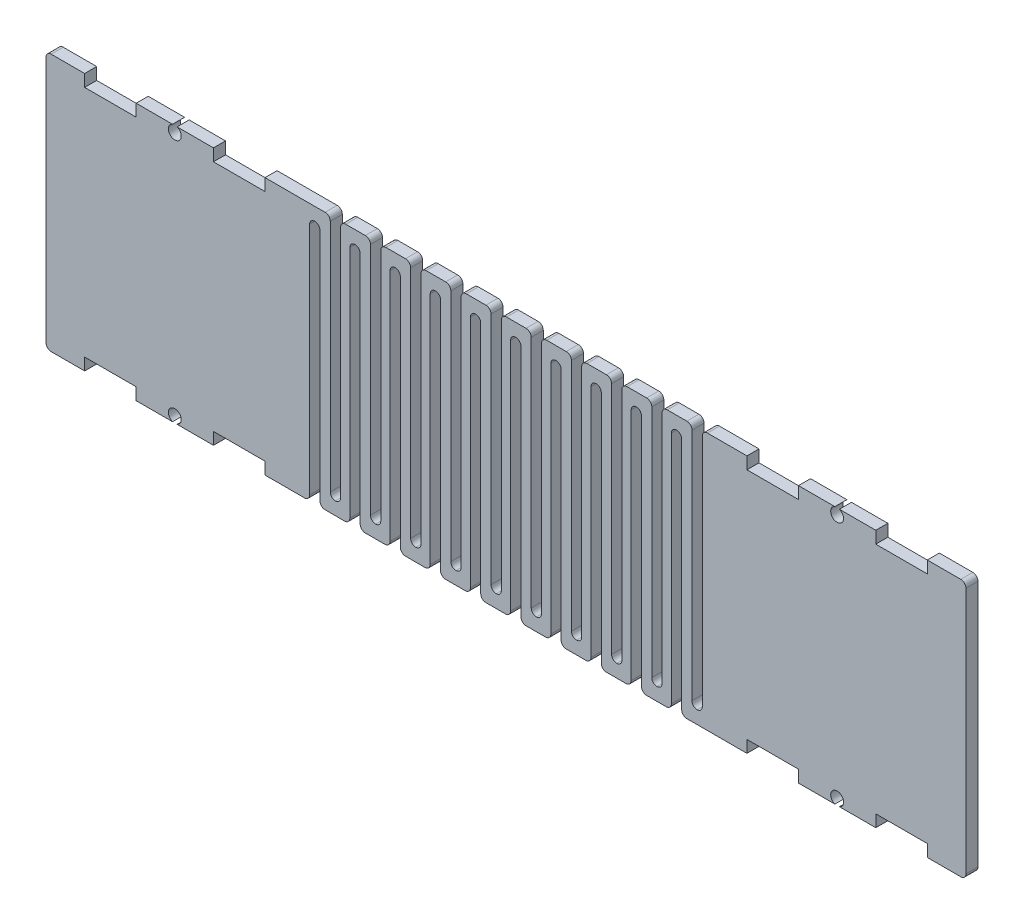
from build123d import *

# Parameters (mm, degrees)
SKETCH1_W               = 226.745566752
SKETCH1_H               = 63.5
BOSS_EXTRUDE1_DEPTH     = 1.4859
CUT_EXTRUDE2_DEPTH      = 118.74403768
CUT_EXTRUDE2_DEPTH_BACK = 118.74403768
SKETCH3_W               = 2.54
SKETCH3_H               = 60.325
FILLET1_R               = 1.27
SKETCH2_R               = 1.5875
SKETCH2_W               = 12.7
SKETCH2_H               = 2.9718
CUT_EXTRUDE1_DEPTH      = 118.772161845


with BuildPart() as part:
    # Sketch1 → Boss-Extrude1 (new, symmetric)
    with BuildSketch(Plane.XY):
        Rectangle(SKETCH1_W, SKETCH1_H)
    extrude(amount=BOSS_EXTRUDE1_DEPTH, both=True)

    # Sketch3 → Cut-Extrude2 (cut, two sides: drawn at the far end of the back side and taken through both)
    with BuildSketch(Plane.XY.offset(-CUT_EXTRUDE2_DEPTH_BACK)):
        with Locations((-37.210909292, -1.5875)):
            Rectangle(SKETCH3_W, SKETCH3_H)
        with Locations((-47.116883376, -1.5875)):
            Rectangle(SKETCH3_W, SKETCH3_H)
        with Locations((-42.036883376, 1.5875)):
            Rectangle(SKETCH3_W, SKETCH3_H)
        with Locations((-32.130909292, 1.5875)):
            Rectangle(SKETCH3_W, SKETCH3_H)
        with Locations((-27.304935209, -1.5875)):
            Rectangle(SKETCH3_W, SKETCH3_H)
        with Locations((-22.224935209, 1.5875)):
            Rectangle(SKETCH3_W, SKETCH3_H)
        with Locations((-17.398961125, -1.5875)):
            Rectangle(SKETCH3_W, SKETCH3_H)
        with Locations((-12.318961125, 1.5875)):
            Rectangle(SKETCH3_W, SKETCH3_H)
        with Locations((-7.492987042, -1.5875)):
            Rectangle(SKETCH3_W, SKETCH3_H)
        with Locations((-2.412987042, 1.5875)):
            Rectangle(SKETCH3_W, SKETCH3_H)
        with Locations((2.412987042, -1.5875)):
            Rectangle(SKETCH3_W, SKETCH3_H)
        with Locations((7.492987042, 1.5875)):
            Rectangle(SKETCH3_W, SKETCH3_H)
        with Locations((12.318961125, -1.5875)):
            Rectangle(SKETCH3_W, SKETCH3_H)
        with Locations((17.398961125, 1.5875)):
            Rectangle(SKETCH3_W, SKETCH3_H)
        with Locations((22.224935209, -1.5875)):
            Rectangle(SKETCH3_W, SKETCH3_H)
        with Locations((27.304935209, 1.5875)):
            Rectangle(SKETCH3_W, SKETCH3_H)
        with Locations((32.130909292, -1.5875)):
            Rectangle(SKETCH3_W, SKETCH3_H)
        with Locations((37.210909292, 1.5875)):
            Rectangle(SKETCH3_W, SKETCH3_H)
        with Locations((42.036883376, -1.5875)):
            Rectangle(SKETCH3_W, SKETCH3_H)
        with Locations((47.116883376, 1.5875)):
            Rectangle(SKETCH3_W, SKETCH3_H)
    extrude(amount=CUT_EXTRUDE2_DEPTH + CUT_EXTRUDE2_DEPTH_BACK, mode=Mode.SUBTRACT)

    # Fillet1
    fillet1_edges = [part.edges().sort_by_distance(p)[0] for p in [
        (-45.846883376, 28.575, 0),
        (-38.480909292, -31.75, 0),
        (-38.480909292, 28.575, 0),
        (-35.940909292, 28.575, 0),
        (-35.940909292, -31.75, 0),
        (-28.574935209, -31.75, 0),
        (-28.574935209, 28.575, 0),
        (-26.034935209, 28.575, 0),
        (-26.034935209, -31.75, 0),
        (-18.668961125, -31.75, 0),
        (-18.668961125, 28.575, 0),
        (-16.128961125, 28.575, 0),
        (-16.128961125, -31.75, 0),
        (-8.762987042, -31.75, 0),
        (-8.762987042, 28.575, 0),
        (-6.222987042, 28.575, 0),
        (-6.222987042, -31.75, 0),
        (1.142987042, -31.75, 0),
        (1.142987042, 28.575, 0),
        (3.682987042, 28.575, 0),
        (3.682987042, -31.75, 0),
        (11.048961125, -31.75, 0),
        (11.048961125, 28.575, 0),
        (13.588961125, 28.575, 0),
        (13.588961125, -31.75, 0),
        (20.954935209, -31.75, 0),
        (20.954935209, 28.575, 0),
        (23.494935209, 28.575, 0),
        (23.494935209, -31.75, 0),
        (28.574935209, 31.75, 0),
        (28.574935209, -28.575, 0),
        (26.034935209, -28.575, 0),
        (26.034935209, 31.75, 0),
        (18.668961125, 31.75, 0),
        (18.668961125, -28.575, 0),
        (16.128961125, -28.575, 0),
        (16.128961125, 31.75, 0),
        (8.762987042, 31.75, 0),
        (8.762987042, -28.575, 0),
        (6.222987042, -28.575, 0),
        (6.222987042, 31.75, 0),
        (-1.142987042, 31.75, 0),
        (-1.142987042, -28.575, 0),
        (-3.682987042, -28.575, 0),
        (-3.682987042, 31.75, 0),
        (-11.048961125, 31.75, 0),
        (-11.048961125, -28.575, 0),
        (-13.588961125, -28.575, 0),
        (-13.588961125, 31.75, 0),
        (-20.954935209, 31.75, 0),
        (-20.954935209, -28.575, 0),
        (-23.494935209, -28.575, 0),
        (-23.494935209, 31.75, 0),
        (-30.860909292, 31.75, 0),
        (-30.860909292, -28.575, 0),
        (-33.400909292, -28.575, 0),
        (-33.400909292, 31.75, 0),
        (-40.766883376, 31.75, 0),
        (-40.766883376, -28.575, 0),
        (-43.306883376, -28.575, 0),
        (-43.306883376, 31.75, 0),
        (-48.386883376, -31.75, 0),
        (-48.386883376, 28.575, 0),
        (-45.846883376, -31.75, 0),
        (30.860909292, 28.575, 0),
        (33.400909292, 28.575, 0),
        (33.400909292, -31.75, 0),
        (40.766883376, -31.75, 0),
        (40.766883376, 28.575, 0),
        (43.306883376, 28.575, 0),
        (43.306883376, -31.75, 0),
        (113.372783376, -31.75, 0),
        (113.372783376, 31.75, 0),
        (48.386883376, 31.75, 0),
        (48.386883376, -28.575, 0),
        (45.846883376, -28.575, 0),
        (45.846883376, 31.75, 0),
        (38.480909292, 31.75, 0),
        (38.480909292, -28.575, 0),
        (35.940909292, -28.575, 0),
        (35.940909292, 31.75, 0),
        (-113.372783376, 31.75, 0),
        (-113.372783376, -31.75, 0),
        (30.860909292, -31.75, 0),
    ]]
    fillet(fillet1_edges, radius=FILLET1_R - 0.0001)  # a hair under: the kernel refuses the full size

    # Sketch2 → Cut-Extrude1 (cut, through all)
    with BuildSketch(Plane.XY.offset(1.4859)):
        with Locations((-81.622783376, -30.2641)):
            Circle(SKETCH2_R)
        with Locations((-81.622783376, 30.2641)):
            Circle(SKETCH2_R)
        with Locations((81.622783376, 30.2641)):
            Circle(SKETCH2_R)
        with Locations((81.622783376, -30.2641)):
            Circle(SKETCH2_R)
        with Locations((-97.497783376, -30.2641)):
            Rectangle(SKETCH2_W, SKETCH2_H)
        with Locations((-65.747783376, -30.2641)):
            Rectangle(SKETCH2_W, SKETCH2_H)
        with Locations((-65.747783376, 30.2641)):
            Rectangle(SKETCH2_W, SKETCH2_H)
        with Locations((-97.497783376, 30.2641)):
            Rectangle(SKETCH2_W, SKETCH2_H)
        with Locations((97.497783376, 30.2641)):
            Rectangle(SKETCH2_W, SKETCH2_H)
        with Locations((65.747783376, 30.2641)):
            Rectangle(SKETCH2_W, SKETCH2_H)
        with Locations((65.747783376, -30.2641)):
            Rectangle(SKETCH2_W, SKETCH2_H)
        with Locations((97.497783376, -30.2641)):
            Rectangle(SKETCH2_W, SKETCH2_H)
    extrude(amount=-CUT_EXTRUDE1_DEPTH, mode=Mode.SUBTRACT)


solid = part.part
